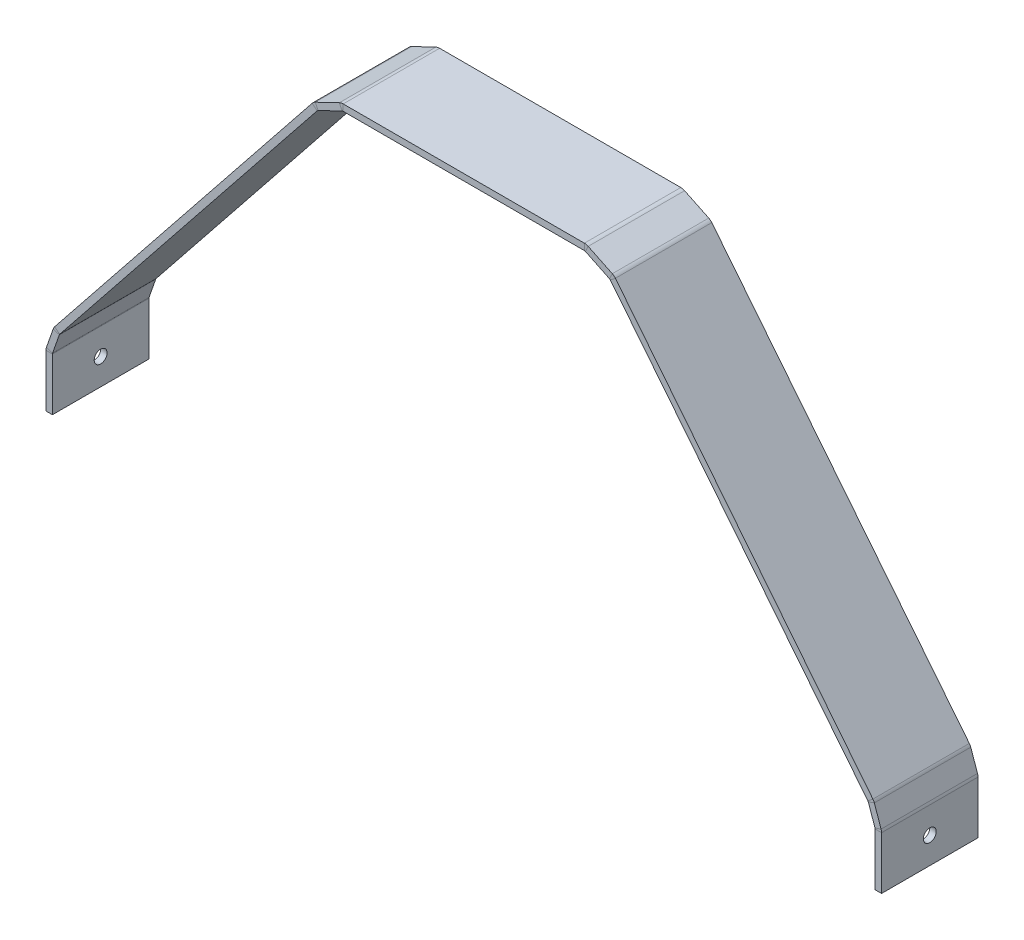
from build123d import *

# Parameters (mm, degrees)
LOFTED_BENDS1_DEPTH     = 30
CUT_EXTRUDE1_DEPTH      = 291.9106392
CUT_EXTRUDE1_DEPTH_BACK = 291.9106392
SKETCH9_R               = 2


# Read off the part's stored shape, not the designer's step: Lofted Bends1
with BuildPart() as part:
    # Lofted Bends1 outline → Lofted Bends1 (new body)
    with BuildSketch(Plane.XY):
        with BuildLine():
            Line((-130, -110.629947141), (-130, -127))
            Line((-130, -127), (-128, -127))
            Line((-128, -127), (-128, -110.629947141))
            ThreePointArc((-128, -110.629947141), (-127.989562576, -110.506385525), (-127.958546096, -110.386325578))
            Line((-127.958546096, -110.386325578), (-125.853702275, -104.380395942))
            ThreePointArc((-125.853702275, -104.380395942), (-125.802985728, -104.267240099), (-125.734006394, -104.164195136))
            Line((-125.734006394, -104.164195136), (-45.607324148, -3.888698057))
            ThreePointArc((-45.607324148, -3.888698057), (-45.490716401, -3.772288571), (-45.351149992, -3.684711448))
            Line((-45.351149992, -3.684711448), (-37.841582221, -0.072791023))
            ThreePointArc((-37.841582221, -0.072791023), (-37.686040501, -0.018428275), (-37.522306162, 0))
            Line((-37.522306162, 0), (37.522306162, 0))
            ThreePointArc((37.522306162, 0), (37.686040501, -0.018428275), (37.841582221, -0.072791023))
            Line((37.841582221, -0.072791023), (45.351149992, -3.684711448))
            ThreePointArc((45.351149992, -3.684711448), (45.490716401, -3.772288571), (45.607324148, -3.888698057))
            Line((45.607324148, -3.888698057), (125.734006394, -104.164195136))
            ThreePointArc((125.734006394, -104.164195136), (125.802985728, -104.267240099), (125.853702275, -104.380395942))
            Line((125.853702275, -104.380395942), (127.958546096, -110.386325578))
            ThreePointArc((127.958546096, -110.386325578), (127.989562576, -110.506385525), (128, -110.629947141))
            Line((128, -110.629947141), (128, -127))
            Line((128, -127), (130, -127))
            Line((130, -127), (130, -110.629947141))
            ThreePointArc((130, -110.629947141), (129.961223114, -110.170893762), (129.845991373, -109.724849709))
            Line((129.845991373, -109.724849709), (127.741147552, -103.718920072))
            ThreePointArc((127.741147552, -103.718920072), (127.55272656, -103.298525993), (127.296456068, -102.91569563))
            Line((127.296456068, -102.91569563), (47.169773822, -2.640198551))
            ThreePointArc((47.169773822, -2.640198551), (46.736555305, -2.207716608), (46.218041274, -1.88235202))
            Line((46.218041274, -1.88235202), (38.708473503, 1.729568405))
            ThreePointArc((38.708473503, 1.729568405), (38.13060835, 1.93153568), (37.522306162, 2))
            Line((37.522306162, 2), (-37.522306162, 2))
            ThreePointArc((-37.522306162, 2), (-38.13060835, 1.93153568), (-38.708473503, 1.729568405))
            Line((-38.708473503, 1.729568405), (-46.218041274, -1.88235202))
            ThreePointArc((-46.218041274, -1.88235202), (-46.736555305, -2.207716608), (-47.169773822, -2.640198551))
            Line((-47.169773822, -2.640198551), (-127.296456068, -102.91569563))
            ThreePointArc((-127.296456068, -102.91569563), (-127.55272656, -103.298525993), (-127.741147552, -103.718920072))
            Line((-127.741147552, -103.718920072), (-129.845991373, -109.724849709))
            ThreePointArc((-129.845991373, -109.724849709), (-129.961223114, -110.170893762), (-130, -110.629947141))
        make_face()
    extrude(amount=LOFTED_BENDS1_DEPTH)

    # Sketch9 → Cut-Extrude1 (cut, two sides: drawn at the far end of the back side and taken through both)
    with BuildSketch(Plane(origin=(130, 0, 0), x_dir=(0, 0, -1), z_dir=(1, 0, 0)).offset(-CUT_EXTRUDE1_DEPTH_BACK)):
        with Locations(Location((-15, -118.814973571, 0), (0, 0, 90))):
            Circle(SKETCH9_R)
    extrude(amount=CUT_EXTRUDE1_DEPTH + CUT_EXTRUDE1_DEPTH_BACK, mode=Mode.SUBTRACT)


solid = part.part
